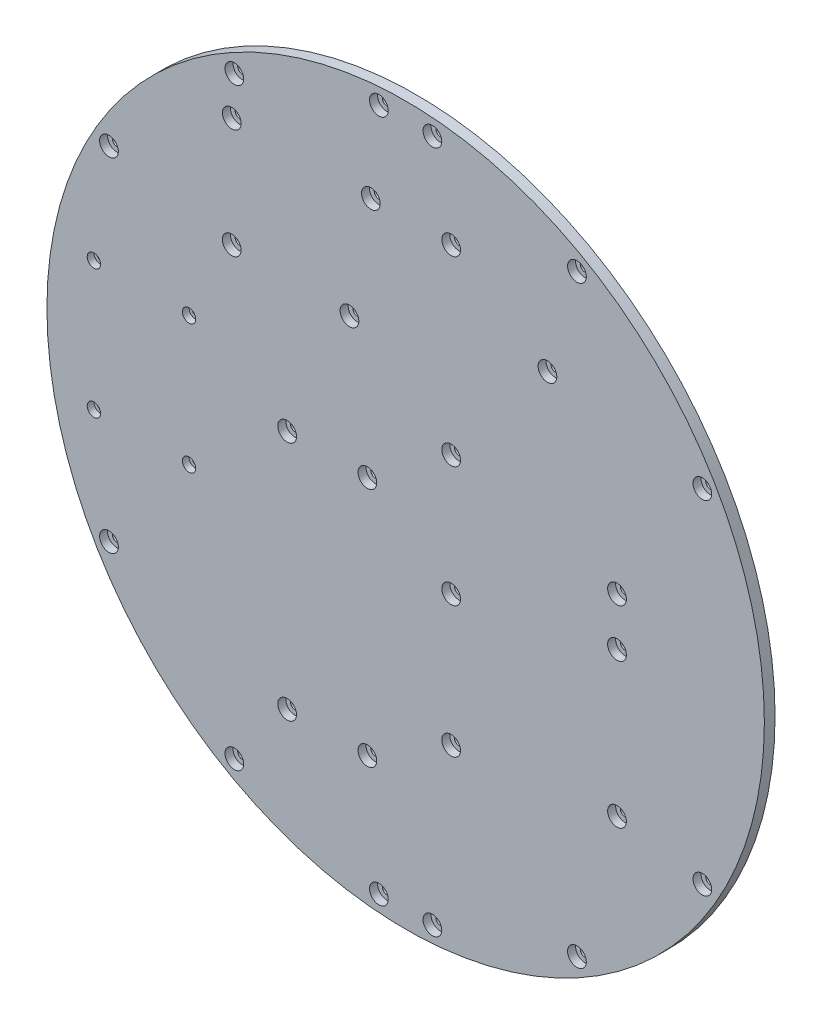
from build123d import *

# Parameters (mm, degrees)
ESQUISSE1_R              = 134.09
ESQUISSE1_R_2            = 1.75
BOSS_EXTRU_1_DEPTH       = 4
ESQUISSE2_R              = 3.5
ENL_V_MAT_EXTRU_1_DEPTH  = 3
ENL_V_MAT_EXTRU_2_REACH  = 191.674
ESQUISSE3_R              = 1.25
ESQUISSE4_R              = 2.5
ENL_V_MAT_EXTRU_3_DEPTH  = 2.5
ENL_V_MAT_EXTRU_4_REACH  = 191.674
ESQUISSE5_R              = 1.75
ESQUISSE6_R              = 3.5
ENL_V_MAT_EXTRU_5_DEPTH  = 3
ENL_V_MAT_EXTRU_6_REACH  = 191.674
ESQUISSE7_R              = 1.75
ESQUISSE8_R              = 3.5
ENL_V_MAT_EXTRU_7_DEPTH  = 3
ENL_V_MAT_EXTRU_8_REACH  = 191.674
ESQUISSE9_R              = 1.75
ESQUISSE10_R             = 3.5
ENL_V_MAT_EXTRU_9_DEPTH  = 3
ENL_V_MAT_EXTRU_10_REACH = 191.674
ESQUISSE11_R             = 1.75
ESQUISSE12_R             = 3.5
ENL_V_MAT_EXTRU_11_DEPTH = 3


with BuildPart() as part:
    # Esquisse1 → Boss.-Extru.1 (new body)
    with BuildSketch(Plane.XY):
        Circle(ESQUISSE1_R)
        with Locations((10, -127.668960989)):
            Circle(ESQUISSE1_R_2, mode=Mode.SUBTRACT)
        with Locations((-10, -127.668960989)):
            Circle(ESQUISSE1_R_2, mode=Mode.SUBTRACT)
        with Locations((10, 127.668960989)):
            Circle(ESQUISSE1_R_2, mode=Mode.SUBTRACT)
        with Locations((-10, 127.668960989)):
            Circle(ESQUISSE1_R_2, mode=Mode.SUBTRACT)
        with Locations((64.03, 110.903213209)):
            Circle(ESQUISSE1_R_2, mode=Mode.SUBTRACT)
        with Locations((110.903213209, 64.03)):
            Circle(ESQUISSE1_R_2, mode=Mode.SUBTRACT)
        with Locations((110.903213209, -64.03)):
            Circle(ESQUISSE1_R_2, mode=Mode.SUBTRACT)
        with Locations((64.03, -110.903213209)):
            Circle(ESQUISSE1_R_2, mode=Mode.SUBTRACT)
        with Locations((-64.03, -110.903213209)):
            Circle(ESQUISSE1_R_2, mode=Mode.SUBTRACT)
        with Locations((-110.903213209, -64.03)):
            Circle(ESQUISSE1_R_2, mode=Mode.SUBTRACT)
        with Locations((-110.903213209, 64.03)):
            Circle(ESQUISSE1_R_2, mode=Mode.SUBTRACT)
        with Locations((-64.03, 110.903213209)):
            Circle(ESQUISSE1_R_2, mode=Mode.SUBTRACT)
    extrude(amount=BOSS_EXTRU_1_DEPTH)

    # Esquisse2 → Enlèv. mat.-Extru.1 (cut)
    with BuildSketch(Plane.XY.offset(4)):
        with Locations((64.03, -110.903213209)):
            Circle(ESQUISSE2_R)
        with Locations((110.903213209, -64.03)):
            Circle(ESQUISSE2_R)
        with Locations((110.903213209, 64.03)):
            Circle(ESQUISSE2_R)
        with Locations((64.03, 110.903213209)):
            Circle(ESQUISSE2_R)
        with Locations((10, 127.668960989)):
            Circle(ESQUISSE2_R)
        with Locations((-10, 127.668960989)):
            Circle(ESQUISSE2_R)
        with Locations((-64.03, 110.903213209)):
            Circle(ESQUISSE2_R)
        with Locations((-110.903213209, 64.03)):
            Circle(ESQUISSE2_R)
        with Locations((-110.903213209, -64.03)):
            Circle(ESQUISSE2_R)
        with Locations((-64.03, -110.903213209)):
            Circle(ESQUISSE2_R)
        with Locations((-10, -127.668960989)):
            Circle(ESQUISSE2_R)
        with Locations((10, -127.668960989)):
            Circle(ESQUISSE2_R)
    extrude(amount=-ENL_V_MAT_EXTRU_1_DEPTH, mode=Mode.SUBTRACT)

    # Esquisse3 → Enlèv. mat.-Extru.2 (cut, up to next)
    with BuildSketch(Plane.XY.offset(4), mode=Mode.PRIVATE) as enl_v_mat_extru_2_sk1:
        with Locations((-116.52786405, -24.13)):
            Circle(ESQUISSE3_R)
    enl_v_mat_extru_2_tool1 = extrude(enl_v_mat_extru_2_sk1.sketch, amount=-ENL_V_MAT_EXTRU_2_REACH, mode=Mode.PRIVATE) & part.part
    # Esquisse3 → Enlèv. mat.-Extru.2 (cut, up to next)
    with BuildSketch(Plane.XY.offset(4), mode=Mode.PRIVATE) as enl_v_mat_extru_2_sk2:
        with Locations((-116.52786405, 24.13)):
            Circle(ESQUISSE3_R)
    enl_v_mat_extru_2_tool2 = extrude(enl_v_mat_extru_2_sk2.sketch, amount=-ENL_V_MAT_EXTRU_2_REACH, mode=Mode.PRIVATE) & part.part
    # Esquisse3 → Enlèv. mat.-Extru.2 (cut, up to next)
    with BuildSketch(Plane.XY.offset(4), mode=Mode.PRIVATE) as enl_v_mat_extru_2_sk3:
        with Locations((-80.96786405, 24.13)):
            Circle(ESQUISSE3_R)
    enl_v_mat_extru_2_tool3 = extrude(enl_v_mat_extru_2_sk3.sketch, amount=-ENL_V_MAT_EXTRU_2_REACH, mode=Mode.PRIVATE) & part.part
    # Esquisse3 → Enlèv. mat.-Extru.2 (cut, up to next)
    with BuildSketch(Plane.XY.offset(4), mode=Mode.PRIVATE) as enl_v_mat_extru_2_sk4:
        with Locations((-80.96786405, -24.13)):
            Circle(ESQUISSE3_R)
    enl_v_mat_extru_2_tool4 = extrude(enl_v_mat_extru_2_sk4.sketch, amount=-ENL_V_MAT_EXTRU_2_REACH, mode=Mode.PRIVATE) & part.part
    add(enl_v_mat_extru_2_tool1.solids().sort_by_distance((-116.527864, -24.13, 4))[0], mode=Mode.SUBTRACT)
    add(enl_v_mat_extru_2_tool2.solids().sort_by_distance((-116.527864, 24.13, 4))[0], mode=Mode.SUBTRACT)
    add(enl_v_mat_extru_2_tool3.solids().sort_by_distance((-80.967864, 24.13, 4))[0], mode=Mode.SUBTRACT)
    add(enl_v_mat_extru_2_tool4.solids().sort_by_distance((-80.967864, -24.13, 4))[0], mode=Mode.SUBTRACT)

    # Esquisse4 → Enlèv. mat.-Extru.3 (cut)
    with BuildSketch(Plane.XY.offset(4)):
        with Locations((-116.52786405, -24.13)):
            Circle(ESQUISSE4_R)
        with Locations((-116.52786405, 24.13)):
            Circle(ESQUISSE4_R)
        with Locations((-80.96786405, 24.13)):
            Circle(ESQUISSE4_R)
        with Locations((-80.96786405, -24.13)):
            Circle(ESQUISSE4_R)
    extrude(amount=-ENL_V_MAT_EXTRU_3_DEPTH, mode=Mode.SUBTRACT)

    # Esquisse5 → Enlèv. mat.-Extru.4 (cut, up to next)
    with BuildSketch(Plane.XY.offset(4), mode=Mode.PRIVATE) as enl_v_mat_extru_4_sk1:
        with Locations((-44.3, -85)):
            Circle(ESQUISSE5_R)
    enl_v_mat_extru_4_tool1 = extrude(enl_v_mat_extru_4_sk1.sketch, amount=-ENL_V_MAT_EXTRU_4_REACH, mode=Mode.PRIVATE) & part.part
    # Esquisse5 → Enlèv. mat.-Extru.4 (cut, up to next)
    with BuildSketch(Plane.XY.offset(4), mode=Mode.PRIVATE) as enl_v_mat_extru_4_sk2:
        with Locations((-44.3, 5)):
            Circle(ESQUISSE5_R)
    enl_v_mat_extru_4_tool2 = extrude(enl_v_mat_extru_4_sk2.sketch, amount=-ENL_V_MAT_EXTRU_4_REACH, mode=Mode.PRIVATE) & part.part
    # Esquisse5 → Enlèv. mat.-Extru.4 (cut, up to next)
    with BuildSketch(Plane.XY.offset(4), mode=Mode.PRIVATE) as enl_v_mat_extru_4_sk3:
        with Locations((-14.3, 5)):
            Circle(ESQUISSE5_R)
    enl_v_mat_extru_4_tool3 = extrude(enl_v_mat_extru_4_sk3.sketch, amount=-ENL_V_MAT_EXTRU_4_REACH, mode=Mode.PRIVATE) & part.part
    # Esquisse5 → Enlèv. mat.-Extru.4 (cut, up to next)
    with BuildSketch(Plane.XY.offset(4), mode=Mode.PRIVATE) as enl_v_mat_extru_4_sk4:
        with Locations((-14.3, -85)):
            Circle(ESQUISSE5_R)
    enl_v_mat_extru_4_tool4 = extrude(enl_v_mat_extru_4_sk4.sketch, amount=-ENL_V_MAT_EXTRU_4_REACH, mode=Mode.PRIVATE) & part.part
    add(enl_v_mat_extru_4_tool1.solids().sort_by_distance((-44.3, -85, 4))[0], mode=Mode.SUBTRACT)
    add(enl_v_mat_extru_4_tool2.solids().sort_by_distance((-44.3, 5, 4))[0], mode=Mode.SUBTRACT)
    add(enl_v_mat_extru_4_tool3.solids().sort_by_distance((-14.3, 5, 4))[0], mode=Mode.SUBTRACT)
    add(enl_v_mat_extru_4_tool4.solids().sort_by_distance((-14.3, -85, 4))[0], mode=Mode.SUBTRACT)

    # Esquisse6 → Enlèv. mat.-Extru.5 (cut)
    with BuildSketch(Plane.XY.offset(4)):
        with Locations((-44.3, -85)):
            Circle(ESQUISSE6_R)
        with Locations((-14.3, -85)):
            Circle(ESQUISSE6_R)
        with Locations((-44.3, 5)):
            Circle(ESQUISSE6_R)
        with Locations((-14.3, 5)):
            Circle(ESQUISSE6_R)
    extrude(amount=-ENL_V_MAT_EXTRU_5_DEPTH, mode=Mode.SUBTRACT)

    # Esquisse7 → Enlèv. mat.-Extru.6 (cut, up to next)
    with BuildSketch(Plane.XY.offset(4), mode=Mode.PRIVATE) as enl_v_mat_extru_6_sk1:
        with Locations((-65, 55)):
            Circle(ESQUISSE7_R)
    enl_v_mat_extru_6_tool1 = extrude(enl_v_mat_extru_6_sk1.sketch, amount=-ENL_V_MAT_EXTRU_6_REACH, mode=Mode.PRIVATE) & part.part
    # Esquisse7 → Enlèv. mat.-Extru.6 (cut, up to next)
    with BuildSketch(Plane.XY.offset(4), mode=Mode.PRIVATE) as enl_v_mat_extru_6_sk2:
        with Locations((-65, 96)):
            Circle(ESQUISSE7_R)
    enl_v_mat_extru_6_tool2 = extrude(enl_v_mat_extru_6_sk2.sketch, amount=-ENL_V_MAT_EXTRU_6_REACH, mode=Mode.PRIVATE) & part.part
    # Esquisse7 → Enlèv. mat.-Extru.6 (cut, up to next)
    with BuildSketch(Plane.XY.offset(4), mode=Mode.PRIVATE) as enl_v_mat_extru_6_sk3:
        with Locations((-21, 54)):
            Circle(ESQUISSE7_R)
    enl_v_mat_extru_6_tool3 = extrude(enl_v_mat_extru_6_sk3.sketch, amount=-ENL_V_MAT_EXTRU_6_REACH, mode=Mode.PRIVATE) & part.part
    # Esquisse7 → Enlèv. mat.-Extru.6 (cut, up to next)
    with BuildSketch(Plane.XY.offset(4), mode=Mode.PRIVATE) as enl_v_mat_extru_6_sk4:
        with Locations((-13, 96)):
            Circle(ESQUISSE7_R)
    enl_v_mat_extru_6_tool4 = extrude(enl_v_mat_extru_6_sk4.sketch, amount=-ENL_V_MAT_EXTRU_6_REACH, mode=Mode.PRIVATE) & part.part
    add(enl_v_mat_extru_6_tool1.solids().sort_by_distance((-65, 55, 4))[0], mode=Mode.SUBTRACT)
    add(enl_v_mat_extru_6_tool2.solids().sort_by_distance((-65, 96, 4))[0], mode=Mode.SUBTRACT)
    add(enl_v_mat_extru_6_tool3.solids().sort_by_distance((-21, 54, 4))[0], mode=Mode.SUBTRACT)
    add(enl_v_mat_extru_6_tool4.solids().sort_by_distance((-13, 96, 4))[0], mode=Mode.SUBTRACT)

    # Esquisse8 → Enlèv. mat.-Extru.7 (cut)
    with BuildSketch(Plane.XY.offset(4)):
        with Locations((-65, 55)):
            Circle(ESQUISSE8_R)
        with Locations((-65, 96)):
            Circle(ESQUISSE8_R)
        with Locations((-21, 54)):
            Circle(ESQUISSE8_R)
        with Locations((-13, 96)):
            Circle(ESQUISSE8_R)
    extrude(amount=-ENL_V_MAT_EXTRU_7_DEPTH, mode=Mode.SUBTRACT)

    # Esquisse9 → Enlèv. mat.-Extru.8 (cut, up to next)
    with BuildSketch(Plane(origin=(0, 0, 0), x_dir=(-1, 0, 0), z_dir=(0, 0, -1)), mode=Mode.PRIVATE) as enl_v_mat_extru_8_sk1:
        with Locations((-17, 96)):
            Circle(ESQUISSE9_R)
    enl_v_mat_extru_8_tool1 = extrude(enl_v_mat_extru_8_sk1.sketch, amount=-ENL_V_MAT_EXTRU_8_REACH, mode=Mode.PRIVATE) & part.part
    # Esquisse9 → Enlèv. mat.-Extru.8 (cut, up to next)
    with BuildSketch(Plane(origin=(0, 0, 0), x_dir=(-1, 0, 0), z_dir=(0, 0, -1)), mode=Mode.PRIVATE) as enl_v_mat_extru_8_sk2:
        with Locations((-17, 28)):
            Circle(ESQUISSE9_R)
    enl_v_mat_extru_8_tool2 = extrude(enl_v_mat_extru_8_sk2.sketch, amount=-ENL_V_MAT_EXTRU_8_REACH, mode=Mode.PRIVATE) & part.part
    # Esquisse9 → Enlèv. mat.-Extru.8 (cut, up to next)
    with BuildSketch(Plane(origin=(0, 0, 0), x_dir=(-1, 0, 0), z_dir=(0, 0, -1)), mode=Mode.PRIVATE) as enl_v_mat_extru_8_sk3:
        with Locations((-53, 73)):
            Circle(ESQUISSE9_R)
    enl_v_mat_extru_8_tool3 = extrude(enl_v_mat_extru_8_sk3.sketch, amount=-ENL_V_MAT_EXTRU_8_REACH, mode=Mode.PRIVATE) & part.part
    # Esquisse9 → Enlèv. mat.-Extru.8 (cut, up to next)
    with BuildSketch(Plane(origin=(0, 0, 0), x_dir=(-1, 0, 0), z_dir=(0, 0, -1)), mode=Mode.PRIVATE) as enl_v_mat_extru_8_sk4:
        with Locations((-79, 14)):
            Circle(ESQUISSE9_R)
    enl_v_mat_extru_8_tool4 = extrude(enl_v_mat_extru_8_sk4.sketch, amount=-ENL_V_MAT_EXTRU_8_REACH, mode=Mode.PRIVATE) & part.part
    add(enl_v_mat_extru_8_tool1.solids().sort_by_distance((17, 96, 0))[0], mode=Mode.SUBTRACT)
    add(enl_v_mat_extru_8_tool2.solids().sort_by_distance((17, 28, 0))[0], mode=Mode.SUBTRACT)
    add(enl_v_mat_extru_8_tool3.solids().sort_by_distance((53, 73, 0))[0], mode=Mode.SUBTRACT)
    add(enl_v_mat_extru_8_tool4.solids().sort_by_distance((79, 14, 0))[0], mode=Mode.SUBTRACT)

    # Esquisse10 → Enlèv. mat.-Extru.9 (cut)
    with BuildSketch(Plane.XY.offset(4)):
        with Locations((17, 28)):
            Circle(ESQUISSE10_R)
        with Locations((17, 96)):
            Circle(ESQUISSE10_R)
        with Locations((53, 73)):
            Circle(ESQUISSE10_R)
        with Locations((79, 14)):
            Circle(ESQUISSE10_R)
    extrude(amount=-ENL_V_MAT_EXTRU_9_DEPTH, mode=Mode.SUBTRACT)

    # Esquisse11 → Enlèv. mat.-Extru.10 (cut, up to next)
    with BuildSketch(Plane(origin=(0, 0, 0), x_dir=(-1, 0, 0), z_dir=(0, 0, -1)), mode=Mode.PRIVATE) as enl_v_mat_extru_10_sk1:
        with Locations((-17, -17)):
            Circle(ESQUISSE11_R)
    enl_v_mat_extru_10_tool1 = extrude(enl_v_mat_extru_10_sk1.sketch, amount=-ENL_V_MAT_EXTRU_10_REACH, mode=Mode.PRIVATE) & part.part
    # Esquisse11 → Enlèv. mat.-Extru.10 (cut, up to next)
    with BuildSketch(Plane(origin=(0, 0, 0), x_dir=(-1, 0, 0), z_dir=(0, 0, -1)), mode=Mode.PRIVATE) as enl_v_mat_extru_10_sk2:
        with Locations((-17, -66)):
            Circle(ESQUISSE11_R)
    enl_v_mat_extru_10_tool2 = extrude(enl_v_mat_extru_10_sk2.sketch, amount=-ENL_V_MAT_EXTRU_10_REACH, mode=Mode.PRIVATE) & part.part
    # Esquisse11 → Enlèv. mat.-Extru.10 (cut, up to next)
    with BuildSketch(Plane(origin=(0, 0, 0), x_dir=(-1, 0, 0), z_dir=(0, 0, -1)), mode=Mode.PRIVATE) as enl_v_mat_extru_10_sk3:
        with Locations((-79, -4)):
            Circle(ESQUISSE11_R)
    enl_v_mat_extru_10_tool3 = extrude(enl_v_mat_extru_10_sk3.sketch, amount=-ENL_V_MAT_EXTRU_10_REACH, mode=Mode.PRIVATE) & part.part
    # Esquisse11 → Enlèv. mat.-Extru.10 (cut, up to next)
    with BuildSketch(Plane(origin=(0, 0, 0), x_dir=(-1, 0, 0), z_dir=(0, 0, -1)), mode=Mode.PRIVATE) as enl_v_mat_extru_10_sk4:
        with Locations((-79, -58)):
            Circle(ESQUISSE11_R)
    enl_v_mat_extru_10_tool4 = extrude(enl_v_mat_extru_10_sk4.sketch, amount=-ENL_V_MAT_EXTRU_10_REACH, mode=Mode.PRIVATE) & part.part
    add(enl_v_mat_extru_10_tool1.solids().sort_by_distance((17, -17, 0))[0], mode=Mode.SUBTRACT)
    add(enl_v_mat_extru_10_tool2.solids().sort_by_distance((17, -66, 0))[0], mode=Mode.SUBTRACT)
    add(enl_v_mat_extru_10_tool3.solids().sort_by_distance((79, -4, 0))[0], mode=Mode.SUBTRACT)
    add(enl_v_mat_extru_10_tool4.solids().sort_by_distance((79, -58, 0))[0], mode=Mode.SUBTRACT)

    # Esquisse12 → Enlèv. mat.-Extru.11 (cut)
    with BuildSketch(Plane.XY.offset(4)):
        with Locations((17, -66)):
            Circle(ESQUISSE12_R)
        with Locations((17, -17)):
            Circle(ESQUISSE12_R)
        with Locations((79, -4)):
            Circle(ESQUISSE12_R)
        with Locations((79, -58)):
            Circle(ESQUISSE12_R)
    extrude(amount=-ENL_V_MAT_EXTRU_11_DEPTH, mode=Mode.SUBTRACT)


solid = part.part
